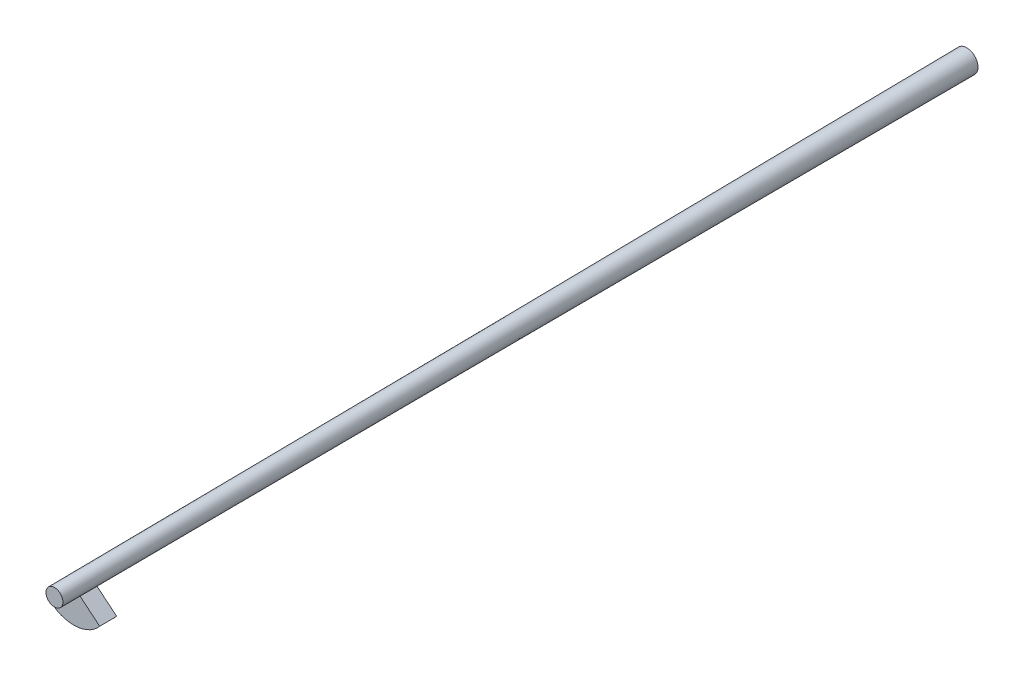
from build123d import *

# Parameters (mm, degrees)
REVOLVE_1_ANGLE = 100


with BuildPart() as part:
    # 放样1: read off the stored shape, not the designer's step
    # 放样1: loft between two sections, ruled curve by curve
    loft_1_from = [
        Edge.make_bspline([(-0.630133871, 2.223513487, 107.54), (-0.694841081, 2.276024643, 107.54), (-0.761652519, 2.343293659, 107.54), (-0.883036961, 2.518727204, 107.54), (-0.937584486, 2.627557912, 107.54), (-1.002413523, 2.886224313, 107.54), (-1.011566009, 3.036607803, 107.54), (-0.951771481, 3.344582311, 107.54), (-0.881508825, 3.500719452, 107.54), (-0.671464201, 3.75954829, 107.54), (-0.533135829, 3.860448783, 107.54), (-0.244067314, 3.982363002, 107.54), (-0.095020748, 4.004364891, 107.54), (0.171451127, 3.994174174, 107.54), (0.289180076, 3.963199181, 107.54), (0.48584451, 3.880529892, 107.54), (0.565426662, 3.828997669, 107.54), (0.694841081, 3.723975357, 107.54), (0.761652519, 3.656706341, 107.54), (0.883036961, 3.481272796, 107.54), (0.937584486, 3.372442088, 107.54), (1.002413523, 3.113775687, 107.54), (1.011566009, 2.963392197, 107.54), (0.951771481, 2.655417689, 107.54), (0.881508825, 2.499280548, 107.54), (0.671464201, 2.24045171, 107.54), (0.533135829, 2.139551217, 107.54), (0.244067314, 2.017636998, 107.54), (0.095020748, 1.995635109, 107.54), (-0.171451127, 2.005825826, 107.54), (-0.289180076, 2.036800819, 107.54), (-0.48584451, 2.119470108, 107.54), (-0.565426662, 2.171002331, 107.54), (-0.630133871, 2.223513487, 107.54)], [0, 0, 0, 0, 0.0625, 0.0625, 0.125, 0.125, 0.1875, 0.1875, 0.25, 0.25, 0.3125, 0.3125, 0.375, 0.375, 0.4375, 0.4375, 0.5, 0.5, 0.5625, 0.5625, 0.625, 0.625, 0.6875, 0.6875, 0.75, 0.75, 0.8125, 0.8125, 0.875, 0.875, 0.9375, 0.9375, 1, 1, 1, 1], 3),
    ]
    loft_1_to = [
        Edge.make_bspline([(-1.257751162, 3.567608956, 0), (-1.293783749, 3.672421553, 0), (-1.321798599, 3.795367125, 0), (-1.335222616, 4.078782721, 0), (-1.320133937, 4.239986455, 0), (-1.211137174, 4.577489269, 0), (-1.115569475, 4.753611411, 0), (-0.831239343, 5.058993186, 0), (-0.642016238, 5.185685988, 0), (-0.22276585, 5.329816336, 0), (0.004360045, 5.34625644, 0), (0.416362735, 5.28026071, 0), (0.600024499, 5.200132373, 0), (0.893508107, 5.000994692, 0), (1.004529945, 4.883145367, 0), (1.168213301, 4.651386088, 0), (1.221718575, 4.537203641, 0), (1.293783749, 4.327578447, 0), (1.321798599, 4.204632875, 0), (1.335222616, 3.921217279, 0), (1.320133937, 3.760013545, 0), (1.211137174, 3.422510731, 0), (1.115569475, 3.246388589, 0), (0.831239343, 2.941006814, 0), (0.642016238, 2.814314012, 0), (0.22276585, 2.670183664, 0), (-0.004360045, 2.65374356, 0), (-0.416362735, 2.71973929, 0), (-0.600024499, 2.799867627, 0), (-0.893508107, 2.999005308, 0), (-1.004529945, 3.116854633, 0), (-1.168213301, 3.348613912, 0), (-1.221718575, 3.462796359, 0), (-1.257751162, 3.567608956, 0)], [0, 0, 0, 0, 0.0625, 0.0625, 0.125, 0.125, 0.1875, 0.1875, 0.25, 0.25, 0.3125, 0.3125, 0.375, 0.375, 0.4375, 0.4375, 0.5, 0.5, 0.5625, 0.5625, 0.625, 0.625, 0.6875, 0.6875, 0.75, 0.75, 0.8125, 0.8125, 0.875, 0.875, 0.9375, 0.9375, 1, 1, 1, 1], 3),
    ]
    loft_1 = Solid(Shell([*[Face.make_surface_from_curves(loft_1_from[k], loft_1_to[k]) for k in range(1)], Face(Wire(loft_1_from)), Face(Wire(loft_1_to))]))
    add(loft_1)


with BuildPart() as body_2:
    # 草图7 → 旋转1 (revolve, symmetric)
    with BuildSketch(Plane(origin=(0, 0, 0), x_dir=(0, 0, -1), z_dir=(1, 0, 0))) as revolve_1_sk:
        Polygon((-105.290043667, 2.014017768), (-103.290082481, 2.026478006), (-103.271391762, -0.973521994), (-105.271352947, -0.985982232), align=None)
    revolve(axis=Axis((0, 4, 0), (0, -0.009298463533136264, 0.9999567683534739)), revolution_arc=REVOLVE_1_ANGLE / 2)
    revolve(revolve_1_sk.sketch, axis=Axis((0, 4, 0), (0, 0.009298463533136264, -0.9999567683534739)), revolution_arc=REVOLVE_1_ANGLE / 2)


solid = Compound([part.part, body_2.part])
